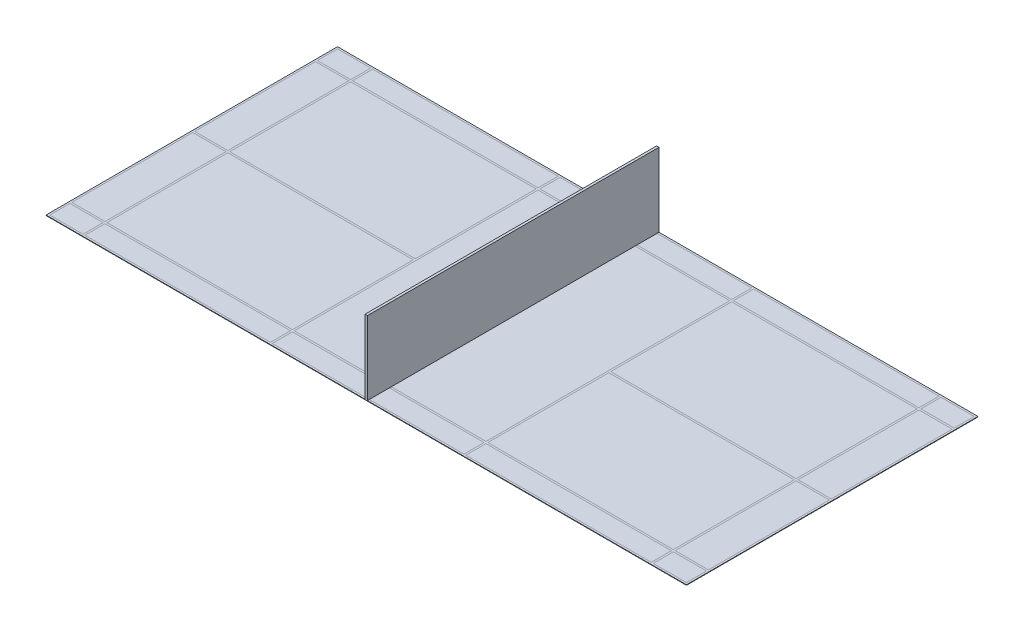
from build123d import *

# Parameters (mm, degrees)
BOSS_EXTRUDE1_DEPTH    = 10
SKETCH1_W              = 1980
SKETCH1_H              = 420
BOSS_EXTRUDE1_2_DEPTH  = 10
SKETCH1_W_2            = 3880
BOSS_EXTRUDE1_3_DEPTH  = 10
SKETCH1_H_2            = 2530
BOSS_EXTRUDE1_4_DEPTH  = 10
SKETCH1_W_3            = 695
BOSS_EXTRUDE1_5_DEPTH  = 10
BOSS_EXTRUDE1_6_DEPTH  = 10
BOSS_EXTRUDE1_7_DEPTH  = 10
BOSS_EXTRUDE1_8_DEPTH  = 10
BOSS_EXTRUDE1_9_DEPTH  = 10
BOSS_EXTRUDE1_10_DEPTH = 10
BOSS_EXTRUDE1_11_DEPTH = 10
SKETCH1_3_W            = 40
SKETCH1_3_H            = 2530
SKETCH1_3_H_2          = 40
SKETCH1_3_W_2          = 695
SKETCH1_3_W_3          = 3880
SKETCH1_3_H_3          = 420
SKETCH1_3_W_4          = 1980
BOSS_EXTRUDE3_DEPTH    = 10
BOSS_EXTRUDE4_DEPTH    = 1550
MIRROR4_START          = 5965
MIRROR4_OUTLINE_W      = 10
MIRROR4_OUTLINE_H      = 420
MIRROR4_DEPTH          = 695
MIRROR4_2_OUTLINE_W    = 10
MIRROR4_2_OUTLINE_H    = 2530
MIRROR4_2_DEPTH        = 695
MIRROR4_START_2        = 20
MIRROR4_3_OUTLINE_W    = 695
MIRROR4_3_OUTLINE_H    = 10
MIRROR4_3_DEPTH        = 2530
MIRROR4_4_OUTLINE_W    = 10
MIRROR4_4_OUTLINE_H    = 420
MIRROR4_4_DEPTH        = 695
MIRROR4_START_3        = 2045
MIRROR4_5_OUTLINE_W    = 10
MIRROR4_5_OUTLINE_H    = 420
MIRROR4_5_DEPTH        = 3880
MIRROR4_START_4        = 25
MIRROR4_6_OUTLINE_W    = 10
MIRROR4_6_OUTLINE_H    = 420
MIRROR4_6_DEPTH        = 1980
MIRROR4_START_5        = -3010
MIRROR4_7_OUTLINE_W    = 1980
MIRROR4_7_OUTLINE_H    = 10
MIRROR4_7_DEPTH        = 420
MIRROR4_8_OUTLINE_W    = 10
MIRROR4_8_OUTLINE_H    = 2530
MIRROR4_8_DEPTH        = 3880
MIRROR4_9_OUTLINE_W    = 10
MIRROR4_9_OUTLINE_H    = 420
MIRROR4_9_DEPTH        = 3880
MIRROR4_10_OUTLINE_W   = 3880
MIRROR4_10_OUTLINE_H   = 10
MIRROR4_10_DEPTH       = 2530
MIRROR4_START_6        = -2550
MIRROR4_11_OUTLINE_W   = 1980
MIRROR4_11_OUTLINE_H   = 10
MIRROR4_11_DEPTH       = 5100


# Read off the part's stored shape, not the designer's step: Mirror4
with BuildPart() as part:
    # Sketch1 → Boss-Extrude1 (new body)
    with BuildSketch(Plane(origin=(0, 0, 0), x_dir=(1, 0, 0), z_dir=(0, 1, 0))):
        Polygon((-25, -2550), (-25, 2550), (-2005, 2550), (-2005, 20), (-2005, -20), (-2005, -2550), align=None)
    extrude(amount=BOSS_EXTRUDE1_DEPTH)


with BuildPart() as body_2:
    # Sketch1 → Boss-Extrude1 2 (new body)
    with BuildSketch(Plane(origin=(0, 0, 0), x_dir=(1, 0, 0), z_dir=(0, 1, 0))):
        with Locations((-1015, -2800)):
            Rectangle(SKETCH1_W, SKETCH1_H)
    extrude(amount=BOSS_EXTRUDE1_2_DEPTH)


with BuildPart() as body_3:
    # Sketch1 → Boss-Extrude1 3 (new body)
    with BuildSketch(Plane(origin=(0, 0, 0), x_dir=(1, 0, 0), z_dir=(0, 1, 0))):
        with Locations((-3985, -2800)):
            Rectangle(SKETCH1_W_2, SKETCH1_H)
    extrude(amount=BOSS_EXTRUDE1_3_DEPTH)


with BuildPart() as body_4:
    # Sketch1 → Boss-Extrude1 4 (new body)
    with BuildSketch(Plane(origin=(0, 0, 0), x_dir=(1, 0, 0), z_dir=(0, 1, 0))):
        with Locations((-3985, -1285)):
            Rectangle(SKETCH1_W_2, SKETCH1_H_2)
    extrude(amount=BOSS_EXTRUDE1_4_DEPTH)


with BuildPart() as body_5:
    # Sketch1 → Boss-Extrude1 5 (new body)
    with BuildSketch(Plane(origin=(0, 0, 0), x_dir=(1, 0, 0), z_dir=(0, 1, 0))):
        with Locations((-6312.5, -1285)):
            Rectangle(SKETCH1_W_3, SKETCH1_H_2)
    extrude(amount=BOSS_EXTRUDE1_5_DEPTH)


with BuildPart() as body_6:
    # Sketch1 → Boss-Extrude1 6 (new body)
    with BuildSketch(Plane(origin=(0, 0, 0), x_dir=(1, 0, 0), z_dir=(0, 1, 0))):
        with Locations((-6312.5, -2800)):
            Rectangle(SKETCH1_W_3, SKETCH1_H)
    extrude(amount=BOSS_EXTRUDE1_6_DEPTH)


with BuildPart() as body_7:
    # Sketch1 → Boss-Extrude1 7 (new body)
    with BuildSketch(Plane(origin=(0, 0, 0), x_dir=(1, 0, 0), z_dir=(0, 1, 0))):
        with Locations((-6312.5, 1285)):
            Rectangle(SKETCH1_W_3, SKETCH1_H_2)
    extrude(amount=BOSS_EXTRUDE1_7_DEPTH)


with BuildPart() as body_8:
    # Sketch1 → Boss-Extrude1 8 (new body)
    with BuildSketch(Plane(origin=(0, 0, 0), x_dir=(1, 0, 0), z_dir=(0, 1, 0))):
        with Locations((-3985, 1285)):
            Rectangle(SKETCH1_W_2, SKETCH1_H_2)
    extrude(amount=BOSS_EXTRUDE1_8_DEPTH)


with BuildPart() as body_9:
    # Sketch1 → Boss-Extrude1 9 (new body)
    with BuildSketch(Plane(origin=(0, 0, 0), x_dir=(1, 0, 0), z_dir=(0, 1, 0))):
        with Locations((-3985, 2800)):
            Rectangle(SKETCH1_W_2, SKETCH1_H)
    extrude(amount=BOSS_EXTRUDE1_9_DEPTH)


with BuildPart() as body_10:
    # Sketch1 → Boss-Extrude1 10 (new body)
    with BuildSketch(Plane(origin=(0, 0, 0), x_dir=(1, 0, 0), z_dir=(0, 1, 0))):
        with Locations((-6312.5, 2800)):
            Rectangle(SKETCH1_W_3, SKETCH1_H)
    extrude(amount=BOSS_EXTRUDE1_10_DEPTH)


with BuildPart() as body_11:
    # Sketch1 → Boss-Extrude1 11 (new body)
    with BuildSketch(Plane(origin=(0, 0, 0), x_dir=(1, 0, 0), z_dir=(0, 1, 0))):
        with Locations((-1015, 2800)):
            Rectangle(SKETCH1_W, SKETCH1_H)
    extrude(amount=BOSS_EXTRUDE1_11_DEPTH)


with BuildPart() as body_12:
    # Sketch1<3> → Boss-Extrude3 (new body)
    with BuildSketch(Plane(origin=(0, 0, 0), x_dir=(1, 0, 0), z_dir=(0, 1, 0))):
        with Locations((-6680, 1285)):
            Rectangle(SKETCH1_3_W, SKETCH1_3_H)
        with Locations((-6680, 0)):
            Rectangle(SKETCH1_3_W, SKETCH1_3_H_2)
        with Locations((-6312.5, 0)):
            Rectangle(SKETCH1_3_W_2, SKETCH1_3_H_2)
        with Locations((-6680, -1285)):
            Rectangle(SKETCH1_3_W, SKETCH1_3_H)
        with Locations((-5945, -1285)):
            Rectangle(SKETCH1_3_W, SKETCH1_3_H)
        with Locations((-5945, 0)):
            Rectangle(SKETCH1_3_W, SKETCH1_3_H_2)
        with Locations((-5945, 1285)):
            Rectangle(SKETCH1_3_W, SKETCH1_3_H)
        with Locations((-3985, 0)):
            Rectangle(SKETCH1_3_W_3, SKETCH1_3_H_2)
        with Locations((-6680, -2800)):
            Rectangle(SKETCH1_3_W, SKETCH1_3_H_3)
        with Locations((-6680, -2570)):
            Rectangle(SKETCH1_3_W, SKETCH1_3_H_2)
        with Locations((-6312.5, -2570)):
            Rectangle(SKETCH1_3_W_2, SKETCH1_3_H_2)
        Polygon((-6700, -3050), (-5965, -3050), (-5965, -3010), (-6660, -3010), (-6700, -3010), align=None)
        with Locations((-5945, -3030)):
            Rectangle(SKETCH1_3_W, SKETCH1_3_H_2)
        with Locations((-5945, -2800)):
            Rectangle(SKETCH1_3_W, SKETCH1_3_H_3)
        with Locations((-3985, -3030)):
            Rectangle(SKETCH1_3_W_3, SKETCH1_3_H_2)
        with Locations((-3985, -2570)):
            Rectangle(SKETCH1_3_W_3, SKETCH1_3_H_2)
        with Locations((-1015, -3030)):
            Rectangle(SKETCH1_3_W_4, SKETCH1_3_H_2)
        with Locations((-2025, -3030)):
            Rectangle(SKETCH1_3_W, SKETCH1_3_H_2)
        with Locations((-2025, -2800)):
            Rectangle(SKETCH1_3_W, SKETCH1_3_H_3)
        with Locations((-1015, -2570)):
            Rectangle(SKETCH1_3_W_4, SKETCH1_3_H_2)
        with Locations((-2025, -2570)):
            Rectangle(SKETCH1_3_W, SKETCH1_3_H_2)
        with Locations((-2025, -1285)):
            Rectangle(SKETCH1_3_W, SKETCH1_3_H)
        with Locations((-3985, 2570)):
            Rectangle(SKETCH1_3_W_3, SKETCH1_3_H_2)
        with Locations((-2025, 2570)):
            Rectangle(SKETCH1_3_W, SKETCH1_3_H_2)
        with Locations((-2025, 2800)):
            Rectangle(SKETCH1_3_W, SKETCH1_3_H_3)
        with Locations((-1015, 2570)):
            Rectangle(SKETCH1_3_W_4, SKETCH1_3_H_2)
        with Locations((-2025, 1285)):
            Rectangle(SKETCH1_3_W, SKETCH1_3_H)
        with Locations((-3985, 3030)):
            Rectangle(SKETCH1_3_W_3, SKETCH1_3_H_2)
        with Locations((-2025, 3030)):
            Rectangle(SKETCH1_3_W, SKETCH1_3_H_2)
        with Locations((-1015, 3030)):
            Rectangle(SKETCH1_3_W_4, SKETCH1_3_H_2)
        Polygon((-5965, 3010), (-5965, 3050), (-6700, 3050), (-6700, 3010), (-6660, 3010), align=None)
        with Locations((-6680, 2800)):
            Rectangle(SKETCH1_3_W, SKETCH1_3_H_3)
        with Locations((-6680, 2570)):
            Rectangle(SKETCH1_3_W, SKETCH1_3_H_2)
        with Locations((-6312.5, 2570)):
            Rectangle(SKETCH1_3_W_2, SKETCH1_3_H_2)
        with Locations((-5945, 2570)):
            Rectangle(SKETCH1_3_W, SKETCH1_3_H_2)
        with Locations((-5945, 2800)):
            Rectangle(SKETCH1_3_W, SKETCH1_3_H_3)
        with Locations((-5945, 3030)):
            Rectangle(SKETCH1_3_W, SKETCH1_3_H_2)
        with Locations((-2025, 0)):
            Rectangle(SKETCH1_3_W, SKETCH1_3_H_2)
        with Locations((-5945, -2570)):
            Rectangle(SKETCH1_3_W, SKETCH1_3_H_2)
    boss_extrude3 = extrude(amount=BOSS_EXTRUDE3_DEPTH)


with BuildPart() as body_13:
    # Sketch1<4> → Boss-Extrude4 (new body)
    with BuildSketch(Plane(origin=(0, 0, 0), x_dir=(1, 0, 0), z_dir=(0, 1, 0))):
        Polygon((25, 3050), (-25, 3050), (-25, 3010), (-25, 2590), (-25, 2550), (-25, -2550), (-25, -2590), (-25, -3010), (-25, -3050), (25, -3050), align=None)
    extrude(amount=BOSS_EXTRUDE4_DEPTH)

    # Mirror2: Boss-Extrude3 across plane
    add(boss_extrude3.mirror(Plane(origin=(0, 0, 0), x_dir=(0, 0, 1), z_dir=(1, 0, 0))))


with BuildPart() as body_14:
    # Mirror4 outline → Mirror4 (new body)
    with BuildSketch(Plane.YZ.offset(MIRROR4_START)):
        with Locations((5, -2800)):
            Rectangle(MIRROR4_OUTLINE_W, MIRROR4_OUTLINE_H)
    extrude(amount=MIRROR4_DEPTH)


with BuildPart() as body_15:
    # Mirror4 2 outline → Mirror4 2 (new body)
    with BuildSketch(Plane.YZ.offset(MIRROR4_START)):
        with Locations((5, -1285)):
            Rectangle(MIRROR4_2_OUTLINE_W, MIRROR4_2_OUTLINE_H)
    extrude(amount=MIRROR4_2_DEPTH)


with BuildPart() as body_16:
    # Mirror4 3 outline → Mirror4 3 (new body)
    with BuildSketch(Plane.XY.offset(MIRROR4_START_2)):
        with Locations((6312.5, 5)):
            Rectangle(MIRROR4_3_OUTLINE_W, MIRROR4_3_OUTLINE_H)
    extrude(amount=MIRROR4_3_DEPTH)


with BuildPart() as body_17:
    # Mirror4 4 outline → Mirror4 4 (new body)
    with BuildSketch(Plane.YZ.offset(MIRROR4_START)):
        with Locations((5, 2800)):
            Rectangle(MIRROR4_4_OUTLINE_W, MIRROR4_4_OUTLINE_H)
    extrude(amount=MIRROR4_4_DEPTH)


with BuildPart() as body_18:
    # Mirror4 5 outline → Mirror4 5 (new body)
    with BuildSketch(Plane.YZ.offset(MIRROR4_START_3)):
        with Locations((5, 2800)):
            Rectangle(MIRROR4_5_OUTLINE_W, MIRROR4_5_OUTLINE_H)
    extrude(amount=MIRROR4_5_DEPTH)


with BuildPart() as body_19:
    # Mirror4 6 outline → Mirror4 6 (new body)
    with BuildSketch(Plane.YZ.offset(MIRROR4_START_4)):
        with Locations((5, 2800)):
            Rectangle(MIRROR4_6_OUTLINE_W, MIRROR4_6_OUTLINE_H)
    extrude(amount=MIRROR4_6_DEPTH)


with BuildPart() as body_20:
    # Mirror4 7 outline → Mirror4 7 (new body)
    with BuildSketch(Plane.XY.offset(MIRROR4_START_5)):
        with Locations((1015, 5)):
            Rectangle(MIRROR4_7_OUTLINE_W, MIRROR4_7_OUTLINE_H)
    extrude(amount=MIRROR4_7_DEPTH)


with BuildPart() as body_21:
    # Mirror4 8 outline → Mirror4 8 (new body)
    with BuildSketch(Plane.YZ.offset(MIRROR4_START_3)):
        with Locations((5, -1285)):
            Rectangle(MIRROR4_8_OUTLINE_W, MIRROR4_8_OUTLINE_H)
    extrude(amount=MIRROR4_8_DEPTH)


with BuildPart() as body_22:
    # Mirror4 9 outline → Mirror4 9 (new body)
    with BuildSketch(Plane.YZ.offset(MIRROR4_START_3)):
        with Locations((5, -2800)):
            Rectangle(MIRROR4_9_OUTLINE_W, MIRROR4_9_OUTLINE_H)
    extrude(amount=MIRROR4_9_DEPTH)


with BuildPart() as body_23:
    # Mirror4 10 outline → Mirror4 10 (new body)
    with BuildSketch(Plane.XY.offset(MIRROR4_START_2)):
        with Locations((3985, 5)):
            Rectangle(MIRROR4_10_OUTLINE_W, MIRROR4_10_OUTLINE_H)
    extrude(amount=MIRROR4_10_DEPTH)


with BuildPart() as body_24:
    # Mirror4 11 outline → Mirror4 11 (new body)
    with BuildSketch(Plane.XY.offset(MIRROR4_START_6)):
        with Locations((1015, 5)):
            Rectangle(MIRROR4_11_OUTLINE_W, MIRROR4_11_OUTLINE_H)
    extrude(amount=MIRROR4_11_DEPTH)


solid = Compound([part.part, body_2.part, body_3.part, body_4.part, body_5.part, body_6.part, body_7.part, body_8.part, body_9.part, body_10.part, body_11.part, body_12.part, body_13.part, body_14.part, body_15.part, body_16.part, body_17.part, body_18.part, body_19.part, body_20.part, body_21.part, body_22.part, body_23.part, body_24.part])
